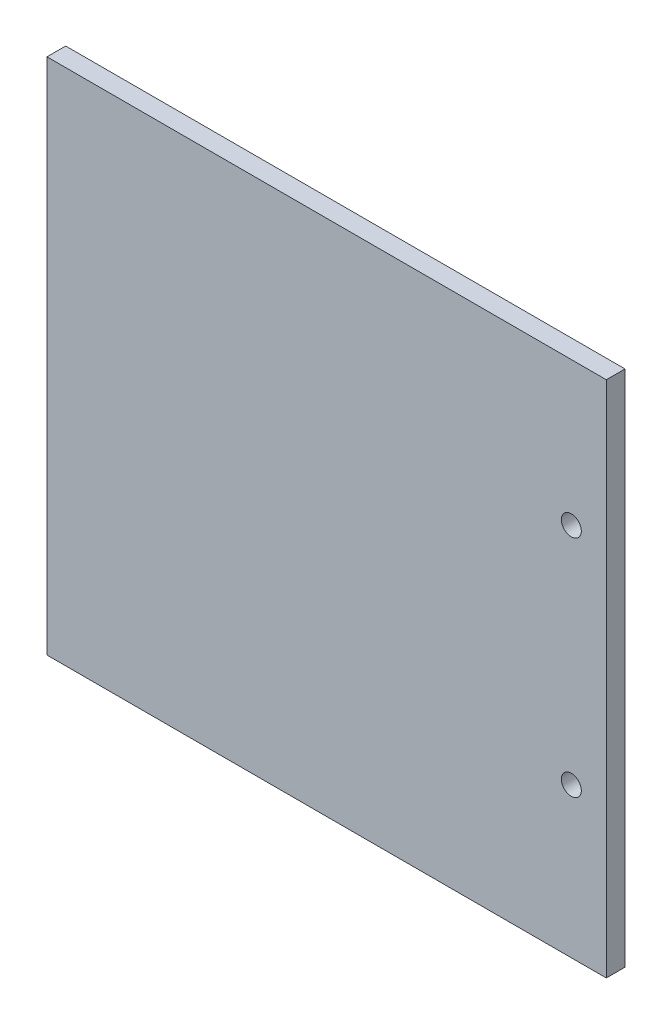
from build123d import *

# Parameters (mm, degrees)
SKETCH1_W           = 142.24
SKETCH1_H           = 131.7625
SKETCH1_R           = 2.54
BOSS_EXTRUDE1_DEPTH = 4.7625


with BuildPart() as part:
    # Sketch1 → Boss-Extrude1 (new body)
    with BuildSketch(Plane.XY):
        with Locations((71.12, 65.88125)):
            Rectangle(SKETCH1_W, SKETCH1_H)
        with Locations((133.35, 38.1)):
            Circle(SKETCH1_R, mode=Mode.SUBTRACT)
        with Locations((133.35, 95.25)):
            Circle(SKETCH1_R, mode=Mode.SUBTRACT)
    extrude(amount=BOSS_EXTRUDE1_DEPTH)


solid = part.part
